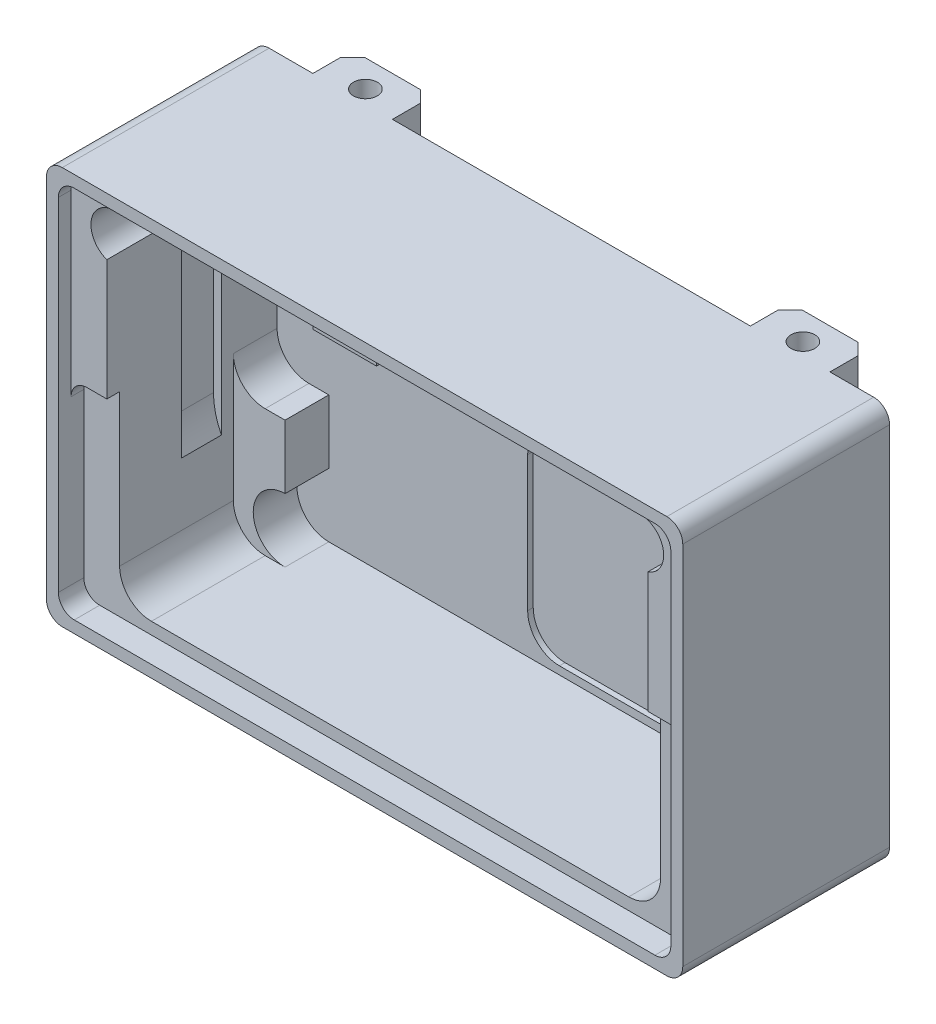
from build123d import *

# Parameters (mm, degrees)
EXTRUDE_1_DEPTH            = 26
CUT_EXTRUDE_1_DEPTH        = 23
CUT_EXTRUDE_2_DEPTH        = 1.6
EXTRUDE_START              = 5.5
EXTRUDE_2_DEPTH            = 5.5
EXTRUDE_START_2            = 17.5
EXTRUDE_3_DEPTH            = 8
CUT_EXTRUDE_3_DEPTH        = 1.6
SKETCH_10_W                = 10
SKETCH_10_H                = 5
EXTRUDE_4_DEPTH            = 5
SKETCH_11_R                = 1.5
CUT_EXTRUDE_4_DEPTH        = 70.108610173
CHAMFER_1_SIZE             = 1.5
CHAMFER_1_OF_MIRROR_2_SIZE = 1.5
MIRROR_START               = -25
MIRROR_3_OUTLINE_R         = 1.5
MIRROR_3_DEPTH             = 5
CUT_EXTRUDE1_START         = 1.5
CUT_EXTRUDE1_DEPTH         = 5
CUT_EXTRUDE_5_DEPTH        = 0.7
CUT_EXTRUDE_6_DEPTH        = 1
SKETCH_16_W                = 13
SKETCH_16_H                = 9.5
CUT_EXTRUDE_10_DEPTH       = 0.5


# Read off the part's stored shape, not the designer's step: Зеркальное отражение3
with BuildPart() as part:
    # Эскиз1 → Бобышка-Вытянуть1 (new body)
    with BuildSketch(Plane.XY):
        with BuildLine():
            Line((-38, -25), (38, -25))
            ThreePointArc((38, -25), (39.414213562, -24.414213562), (40, -23))
            Line((40, -23), (40, 23))
            ThreePointArc((40, 23), (39.414213562, 24.414213562), (38, 25))
            Line((38, 25), (-38, 25))
            ThreePointArc((-38, 25), (-39.414213562, 24.414213562), (-40, 23))
            Line((-40, 23), (-40, -23))
            ThreePointArc((-40, -23), (-39.414213562, -24.414213562), (-38, -25))
        make_face()
    extrude(amount=EXTRUDE_1_DEPTH)

    # Эскиз4 → Вырез-Вытянуть1 (cut)
    with BuildSketch(Plane.XY.offset(26)):
        with BuildLine():
            Line((-33, 22), (33, 22))
            ThreePointArc((33, 22), (35.956795679, 19.507305936), (34, 16.171572875))
            Line((34, 16.171572875), (34, 13.509108241))
            Line((34, 13.509108241), (34, -18))
            ThreePointArc((34, -18), (32.828427125, -20.828427125), (30, -22))
            Line((30, -22), (-30, -22))
            ThreePointArc((-30, -22), (-32.828427125, -20.828427125), (-34, -18))
            Line((-34, -18), (-34, 13.509108241))
            Line((-34, 13.509108241), (-34, 16.171572875))
            ThreePointArc((-34, 16.171572875), (-35.956795679, 19.507305936), (-33, 22))
        make_face()
    extrude(amount=-CUT_EXTRUDE_1_DEPTH, mode=Mode.SUBTRACT)

    # Эскиз6 → Вырез-Вытянуть2 (cut)
    with BuildSketch(Plane.XY.offset(26)):
        with BuildLine():
            Line((-36.5, 23.5), (36.5, 23.5))
            ThreePointArc((36.5, 23.5), (37.914213562, 22.914213562), (38.5, 21.5))
            Line((38.5, 21.5), (38.5, -21.5))
            ThreePointArc((38.5, -21.5), (37.914213562, -22.914213562), (36.5, -23.5))
            Line((36.5, -23.5), (-36.5, -23.5))
            ThreePointArc((-36.5, -23.5), (-37.914213562, -22.914213562), (-38.5, -21.5))
            Line((-38.5, -21.5), (-38.5, 21.5))
            ThreePointArc((-38.5, 21.5), (-37.914213562, 22.914213562), (-36.5, 23.5))
        make_face()
    extrude(amount=-CUT_EXTRUDE_2_DEPTH, mode=Mode.SUBTRACT)

    # Эскиз7 → Бобышка-Вытянуть2 (add)
    with BuildSketch(Plane.XY.offset(3).offset(EXTRUDE_START)):
        with BuildLine():
            Line((-27.5, -6), (-30, -6))
            ThreePointArc((-30, -6), (-32.828427125, -4.828427125), (-34, -2))
            Line((-34, -2), (-34, -18))
            ThreePointArc((-34, -18), (-32.828427125, -20.828427125), (-30, -22))
            Line((-30, -22), (-27.5, -22))
            ThreePointArc((-27.5, -22), (-31.5, -18), (-27.5, -14))
            Line((-27.5, -14), (-27.5, -6))
        make_face()
    extrude_2 = extrude(amount=-EXTRUDE_2_DEPTH)

    # Зеркальное отражение4: Бобышка-Вытянуть2 across plane
    add(extrude_2.mirror(Plane(origin=(0, 0, 0), x_dir=(0, 0, 1), z_dir=(1, 0, 0))))

    # Эскиз8 → Бобышка-Вытянуть3 (add)
    with BuildSketch(Plane(origin=(0, 0, 0), x_dir=(0, 0, -1), z_dir=(1, 0, 0)).offset(EXTRUDE_START_2)):
        Polygon((-6, 7.136038969), (-3, 7.136038969), (-3, 4.136038969), (-7, 4.136038969), (-7, 6.136038969), align=None)
    extrude_3 = extrude(amount=EXTRUDE_3_DEPTH)

    # Зеркальное отражение1: Бобышка-Вытянуть3 across plane
    add(extrude_3.mirror(Plane(origin=(0, 0, 0), x_dir=(0, 0, 1), z_dir=(1, 0, 0))))

    # Эскиз9 → Вырез-Вытянуть3 (cut)
    with BuildSketch(Plane.XY.offset(24.4)):
        with BuildLine():
            Line((-36.5, -23.5), (36.5, -23.5))
            ThreePointArc((36.5, -23.5), (37.914213562, -22.914213562), (38.5, -21.5))
            Line((38.5, -21.5), (38.5, -1))
            ThreePointArc((38.5, -1), (37.914213562, 0.414213562), (36.5, 1))
            Line((36.5, 1), (-36.5, 1))
            ThreePointArc((-36.5, 1), (-37.914213562, 0.414213562), (-38.5, -1))
            Line((-38.5, -1), (-38.5, -21.5))
            ThreePointArc((-38.5, -21.5), (-37.914213562, -22.914213562), (-36.5, -23.5))
        make_face()
    extrude(amount=-CUT_EXTRUDE_3_DEPTH, mode=Mode.SUBTRACT)

    # Эскиз10 → Бобышка-Вытянуть4 (add)
    with BuildSketch(Plane(origin=(0, 0, 0), x_dir=(-1, 0, 0), z_dir=(0, 0, -1))):
        with Locations((-27.5, 22.5)):
            Rectangle(SKETCH_10_W, SKETCH_10_H)
    extrude_4 = extrude(amount=EXTRUDE_4_DEPTH)

    # Эскиз11 → Вырез-Вытянуть4 (cut, through all)
    with BuildSketch(Plane(origin=(0, 25, 0), x_dir=(1, 0, 0), z_dir=(0, 1, 0))):
        with Locations(Location((27.5, 1.6, 0), (0, 0, 180))):
            Circle(SKETCH_11_R)
    cut_extrude_4 = extrude(amount=-CUT_EXTRUDE_4_DEPTH, mode=Mode.SUBTRACT)

    # Фаска1
    chamfer_1_edges = [part.edges().sort_by_distance(p)[0] for p in [
        (32.5, 22.5, -5),
        (22.5, 22.5, -5),
    ]]
    chamfer(chamfer_1_edges, length=CHAMFER_1_SIZE)

    # Зеркальное отражение2: Бобышка-Вытянуть4, Вырез-Вытянуть4 across plane
    add(extrude_4.mirror(Plane(origin=(0, 0, 0), x_dir=(0, 0, 1), z_dir=(1, 0, 0))))
    add(cut_extrude_4.mirror(Plane(origin=(0, 0, 0), x_dir=(0, 0, 1), z_dir=(1, 0, 0))), mode=Mode.SUBTRACT)

    # Фаска1 of Зеркальное отражение2
    chamfer_1_of_mirror_2_edges = [part.edges().sort_by_distance(p)[0] for p in [
        (-32.5, 22.5, -5),
        (-22.5, 22.5, -5),
    ]]
    chamfer(chamfer_1_of_mirror_2_edges, length=CHAMFER_1_OF_MIRROR_2_SIZE)

    # Зеркальное отражение3 outline → Зеркальное отражение3 (add)
    # profile 1 of 2: a face of its own
    with BuildSketch(Plane(origin=(0, 0, 0), x_dir=(1, 0, 0), z_dir=(0, 1, 0)).offset(MIRROR_START)):
        Polygon((22.5, 0), (32.5, 0), (32.5, 3.5), (31, 5), (24, 5), (22.5, 3.5), align=None)
        with Locations((27.5, 1.6)):
            Circle(MIRROR_3_OUTLINE_R, mode=Mode.SUBTRACT)
    # profile 2 of 2: a face of its own
    with BuildSketch(Plane(origin=(0, 0, 0), x_dir=(1, 0, 0), z_dir=(0, 1, 0)).offset(MIRROR_START)):
        Polygon((-32.5, 0), (-22.5, 0), (-22.5, 3.5), (-24, 5), (-31, 5), (-32.5, 3.5), align=None)
        with Locations((-27.5, 1.6)):
            Circle(MIRROR_3_OUTLINE_R, mode=Mode.SUBTRACT)
    extrude(amount=MIRROR_3_DEPTH)

    # Sketch1 → Cut-Extrude1 (cut)
    with BuildSketch(Plane.XY.offset(8.5).offset(CUT_EXTRUDE1_START)):
        with BuildLine():
            Line((35, 12), (35, -6))
            ThreePointArc((35, -6), (34.746427842, -8.121320344), (34, -10.123105626))
            Line((34, -10.123105626), (34, 16.123105626))
            ThreePointArc((34, 16.123105626), (34.746427842, 14.121320344), (35, 12))
        make_face()
    cut_extrude1 = extrude(amount=CUT_EXTRUDE1_DEPTH, mode=Mode.SUBTRACT)

    # Mirror1: Cut-Extrude1 across plane
    add(cut_extrude1.mirror(Plane(origin=(0, 0, 0), x_dir=(0, 0, 1), z_dir=(1, 0, 0))), mode=Mode.SUBTRACT)

    # Эскиз13 → Вырез-Вытянуть5 (cut)
    with BuildSketch(Plane.XY.offset(3)):
        with BuildLine():
            Line((15.5, 4), (16.5, 4))
            ThreePointArc((16.5, 4), (19.328427125, 2.828427125), (20.5, 0))
            Line((20.5, 0), (20.5, -17))
            ThreePointArc((20.5, -17), (19.328427125, -19.828427125), (16.5, -21))
            Line((16.5, -21), (1.5, -21))
            ThreePointArc((1.5, -21), (-1.328427125, -19.828427125), (-2.5, -17))
            Line((-2.5, -17), (-2.5, 0))
            ThreePointArc((-2.5, 0), (-1.328427125, 2.828427125), (1.5, 4))
            Line((1.5, 4), (2.5, 4))
            Line((2.5, 4), (15.5, 4))
        make_face()
    extrude(amount=-CUT_EXTRUDE_5_DEPTH, mode=Mode.SUBTRACT)

    # Эскиз14 → Вырез-Вытянуть6 (cut)
    with BuildSketch(Plane.XY.offset(3)):
        with BuildLine():
            Line((-30, 22), (20, 22))
            ThreePointArc((20, 22), (24.25, 17.75), (20, 13.5))
            Line((20, 13.5), (-30, 13.5))
            ThreePointArc((-30, 13.5), (-34.25, 17.75), (-30, 22))
        make_face()
    extrude(amount=-CUT_EXTRUDE_6_DEPTH, mode=Mode.SUBTRACT)

    # Эскиз16 → Вырез-Вытянуть10 (cut)
    with BuildSketch(Plane.XY.offset(3)):
        with Locations((9, 8.75)):
            Rectangle(SKETCH_16_W, SKETCH_16_H)
    extrude(amount=-CUT_EXTRUDE_10_DEPTH, mode=Mode.SUBTRACT)


solid = part.part
